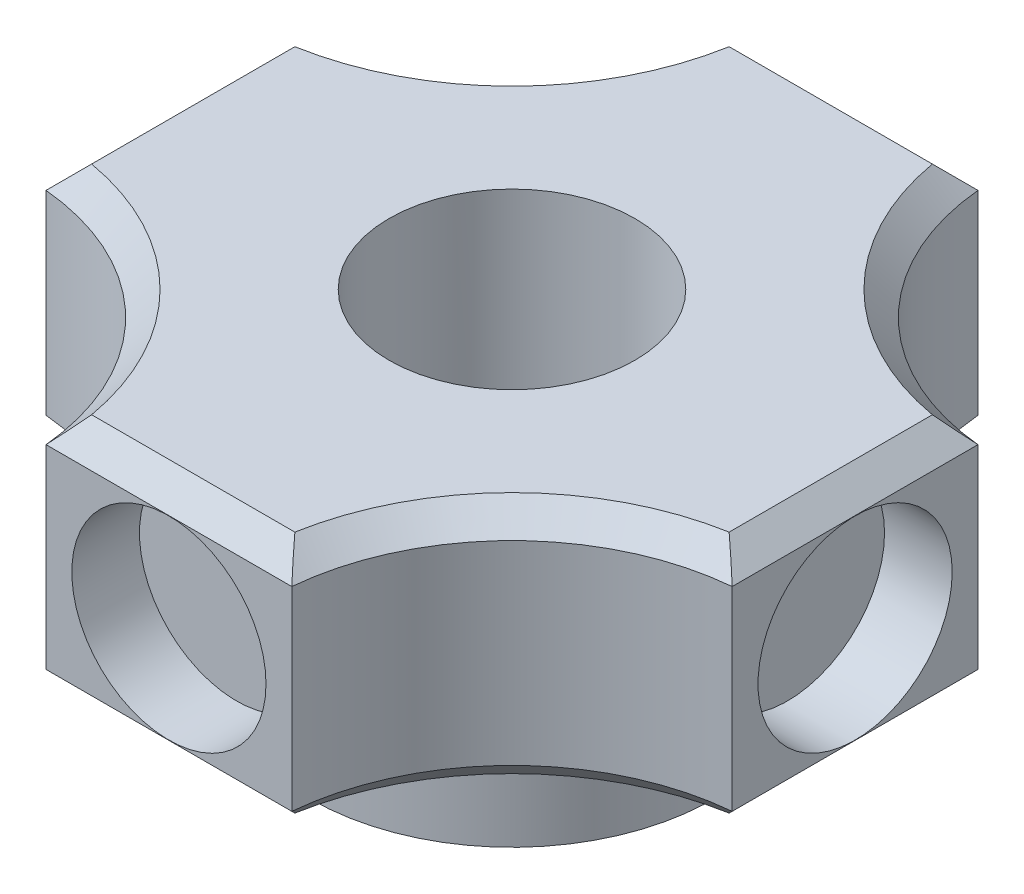
from build123d import *

# Parameters (mm, degrees)
SKETCH1_R           = 5.05
BOSS_EXTRUDE1_DEPTH = 10
SKETCH2_R           = 3.99
CUT_EXTRUDE1_DEPTH  = 2.78
CIRPATTERN1_COUNT   = 4
FILLET1_R           = 10
CHAMFER1_SIZE       = 1
BOSS_EXTRUDE2_START = 4
SKETCH3_R           = 8.279823011
SKETCH3_R_2         = 5.05
BOSS_EXTRUDE2_DEPTH = 4


with BuildPart() as part:
    # Sketch1 → Boss-Extrude1 (new body)
    with BuildSketch(Plane(origin=(0, 0, 0), x_dir=(1, 0, 0), z_dir=(0, 1, 0))):
        Polygon((-5.05, 5.05), (-5.05, 14.097745365), (5.05, 14.097745365), (5.05, 5.05), (14.097745365, 5.05), (14.097745365, -5.05), (5.05, -5.05), (5.05, -14.097745365), (-5.05, -14.097745365), (-5.05, -5.05), (-14.097745365, -5.05), (-14.097745365, 5.05), align=None)
        with Locations(Location((0, 0, 0), (0, 0, 270))):
            Circle(SKETCH1_R, mode=Mode.SUBTRACT)
    extrude(amount=BOSS_EXTRUDE1_DEPTH)

    # Sketch2 → Cut-Extrude1 (cut)
    with BuildSketch(Plane.XY.offset(14.097745365)):
        with Locations((0, 5)):
            Circle(SKETCH2_R)
    cut_extrude1 = extrude(amount=-CUT_EXTRUDE1_DEPTH, mode=Mode.SUBTRACT)

    # CirPattern1: Cut-Extrude1 ×4 about axis
    cirpattern1_axis = Axis((0, 0, 0), (0, 1, 0))
    for i in range(1, CIRPATTERN1_COUNT):
        add(cut_extrude1.rotate(cirpattern1_axis, i * 360 / CIRPATTERN1_COUNT), mode=Mode.SUBTRACT)

    # Fillet1
    # the kernel refuses this fillet: 10 mm, written as the material it adds along each edge
    with BuildSketch(Plane(origin=(5.05, 0, 5.05), x_dir=(1, 0, 0), z_dir=(0, 1, 0)), Plane(origin=(-5.05, 0, 5.05), x_dir=(0, 0, 1), z_dir=(0, 1, 0)), Plane(origin=(5.05, 0, -5.05), x_dir=(0, 0, -1), z_dir=(0, 1, 0))) as fillet1_piece_1:
        with BuildLine():
            CenterArc((9.95844497, -9.95844497), FILLET1_R, 95.225164117, 79.549671766)
            Line((0, -9.047745365), (0, 0))
            Line((0, 0), (9.047745365, 0))
        make_face()
    extrude(amount=10)
    with BuildSketch(Plane(origin=(-5.05, 0, -5.05), x_dir=(0, 0, -1), z_dir=(0, 1, 0))) as fillet1_piece_2:
        with BuildLine():
            CenterArc((9.95844497, 9.95844497), FILLET1_R, 185.225164117, 79.549671766)
            Line((0, 9.047745365), (0, 0))
            Line((0, 0), (9.047745365, 0))
        make_face()
    extrude(amount=10)

    # Chamfer1
    chamfer1_edges = [part.edges().sort_by_distance(p)[0] for p in [
        (0, 10, 14.097745365),
        (-14.097745365, 0, 0),
        (0, 0, -14.097745365),
        (14.097745365, 0, 0),
        (0, 0, 14.097745365),
        (14.097745365, 10, 0),
        (0, 10, -14.097745365),
        (-14.097745365, 10, 0),
        (7.937377159, 0, 7.937377159),
        (7.937377159, 10, 7.937377159),
        (-7.937377159, 0, 7.937377159),
        (-7.937377159, 10, 7.937377159),
        (-7.937377159, 0, -7.937377159),
        (-7.937377159, 10, -7.937377159),
        (7.937377159, 0, -7.937377159),
        (7.937377159, 10, -7.937377159),
    ]]
    chamfer(chamfer1_edges, length=CHAMFER1_SIZE)

    # Sketch3 → Boss-Extrude2 (add)
    with BuildSketch(Plane.XZ.offset(BOSS_EXTRUDE2_START)):
        with Locations(Location((0, 0, 0), (0, 0, 270))):
            Circle(SKETCH3_R)
        with Locations(Location((0, 0, 0), (0, 0, 270))):
            Circle(SKETCH3_R_2, mode=Mode.SUBTRACT)
    extrude(amount=-BOSS_EXTRUDE2_DEPTH)


solid = part.part
